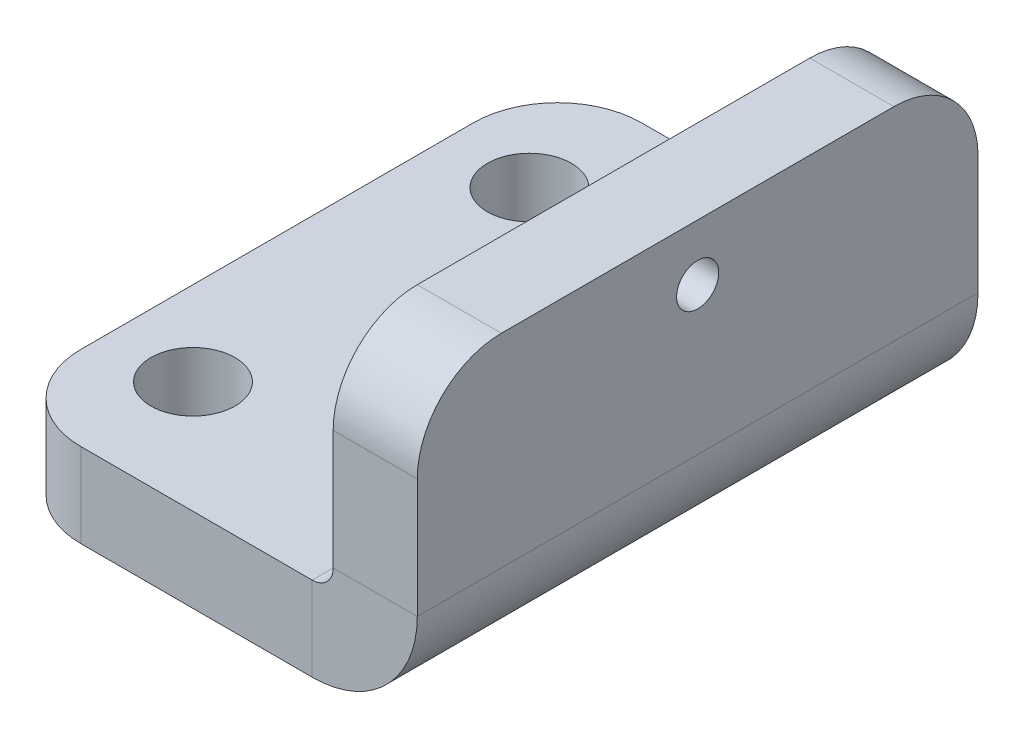
from build123d import *

# Parameters (mm, degrees)
BASE_FLANGE1_DEPTH = 10
FILLET1_R          = 3
SKETCH6_R          = 1.5
CUT_EXTRUDE1_DEPTH = 18.549928775
SKETCH7_R          = 0.75
CUT_EXTRUDE2_DEPTH = 18.549928775


# Sheet-metal steps are written as plain solids
with BuildPart() as part:
    # Sketch1 → Base-Flange1 (new, symmetric)
    with BuildSketch(Plane.XY):
        with BuildLine():
            Line((-12, 0), (-0.75, 0))
            ThreePointArc((-0.75, 0), (-0.219669914, 0.219669914), (0, 0.75))
            Line((0, 0.75), (0, 8))
            Line((0, 8), (3, 8))
            Line((3, 8), (3, 0.75))
            ThreePointArc((3, 0.75), (1.901650429, -1.901650429), (-0.75, -3))
            Line((-0.75, -3), (-12, -3))
            Line((-12, -3), (-12, 0))
        make_face()
    extrude(amount=BASE_FLANGE1_DEPTH, both=True)

    # Fillet1
    fillet1_edges = [part.edges().sort_by_distance(p)[0] for p in [
        (-12, -1.5, 10),
        (-12, -1.5, -10),
        (1.5, 8, 10),
        (1.5, 8, -10),
    ]]
    fillet(fillet1_edges, radius=FILLET1_R)

    # Sketch6 → Cut-Extrude1 (cut, through all)
    with BuildSketch(Plane(origin=(0, 0, 0), x_dir=(1, 0, 0), z_dir=(0, 1, 0))):
        with Locations(Location((-9, 6, 0), (0, 0, 270))):
            Circle(SKETCH6_R)
        with Locations(Location((-9, -6, 0), (0, 0, 90))):
            Circle(SKETCH6_R)
    extrude(amount=-CUT_EXTRUDE1_DEPTH, mode=Mode.SUBTRACT)

    # Sketch7 → Cut-Extrude2 (cut, through all)
    with BuildSketch(Plane.ZY):
        with Locations((0, 6)):
            Circle(SKETCH7_R)
    extrude(amount=-CUT_EXTRUDE2_DEPTH, mode=Mode.SUBTRACT)


solid = part.part
